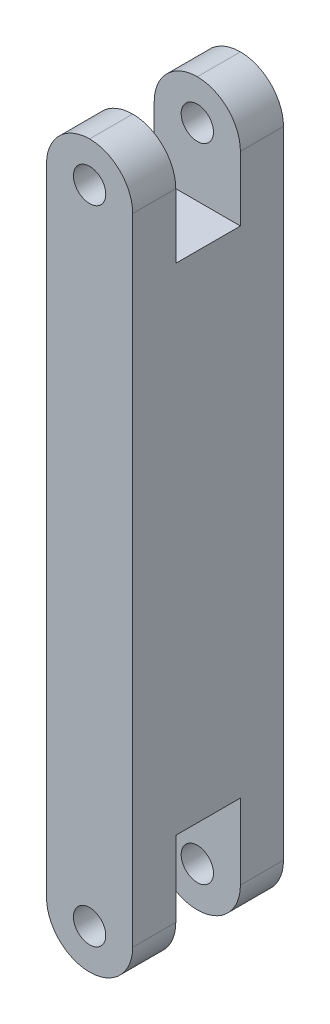
from build123d import *

# Parameters (mm, degrees)
SKETCH1_W           = 8
SKETCH1_H           = 66.99
SKETCH1_R           = 1.5
BOSS_EXTRUDE1_DEPTH = 14
FILLET1_R           = 4
SKETCH2_W           = 6
SKETCH2_H           = 10
SKETCH2_H_2         = 11
CUT_EXTRUDE1_DEPTH  = 38.174117676


with BuildPart() as part:
    # Sketch1 → Boss-Extrude1 (new body)
    with BuildSketch(Plane.XY):
        Rectangle(SKETCH1_W, SKETCH1_H)
        with Locations((0, 29.795)):
            Circle(SKETCH1_R, mode=Mode.SUBTRACT)
        with Locations((0, -29.795)):
            Circle(SKETCH1_R, mode=Mode.SUBTRACT)
    extrude(amount=BOSS_EXTRUDE1_DEPTH)

    # Fillet1
    fillet1_edges = [part.edges().sort_by_distance(p)[0] for p in [
        (-4, -33.495, 7),
        (4, -33.495, 7),
        (-4, 33.495, 7),
        (4, 33.495, 7),
    ]]
    fillet(fillet1_edges, radius=FILLET1_R - 0.0001)  # a hair under: the kernel refuses the full size

    # Sketch2 → Cut-Extrude1 (cut, through all)
    with BuildSketch(Plane.ZY.offset(4)):
        with Locations((7, 28.495)):
            Rectangle(SKETCH2_W, SKETCH2_H)
        with Locations((7, -27.995)):
            Rectangle(SKETCH2_W, SKETCH2_H_2)
    extrude(amount=-CUT_EXTRUDE1_DEPTH, mode=Mode.SUBTRACT)


solid = part.part
